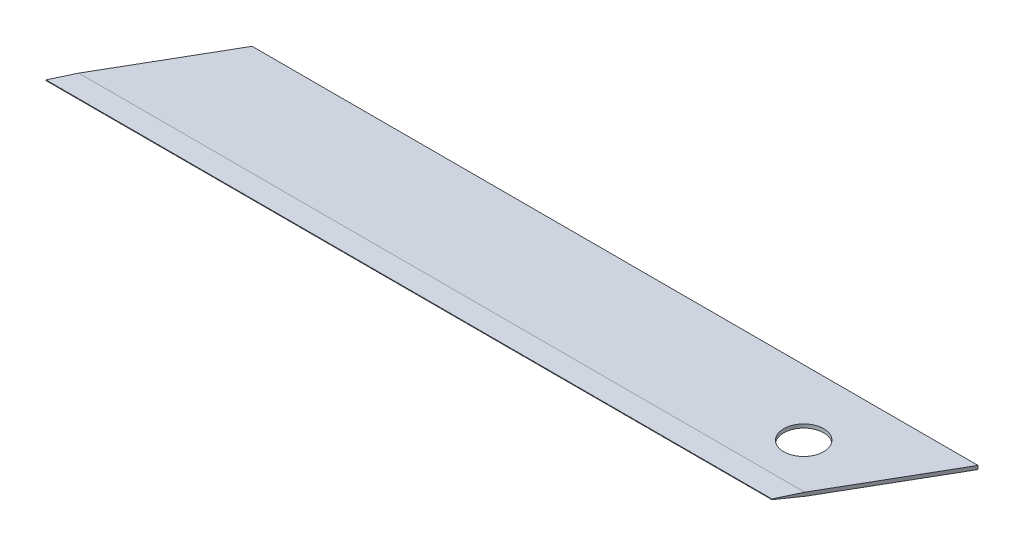
from build123d import *

# Parameters (mm, degrees)
EXTRUDE_1_DEPTH     = 0.5
SKETCH_2_R          = 2.75
CUT_EXTRUDE_1_DEPTH = 10
CHAMFER_1_SIZE      = 3
CHAMFER_1_SIZE2     = 0.209780436
CHAMFER_2_SIZE      = 0.2
CHAMFER_2_SIZE2     = 2.860133251


with BuildPart() as part:
    # 草图1 → 凸台-拉伸1 (new body)
    with BuildSketch(Plane(origin=(0, 0, 0), x_dir=(1, 0, 0), z_dir=(0, 1, 0))):
        Polygon((0, 0), (10.392304845, 18), (110.392304845, 18), (100, 0), align=None)
    extrude(amount=EXTRUDE_1_DEPTH)

    # 草图2 → 切除-拉伸1 (cut)
    with BuildSketch(Plane(origin=(0, 0, 0), x_dir=(-1, 0, 0), z_dir=(0, -1, 0))):
        with Locations((-95.381197846, 9)):
            Circle(SKETCH_2_R)
    extrude(amount=-CUT_EXTRUDE_1_DEPTH, mode=Mode.SUBTRACT)

    # 倒角1
    chamfer_1_edges = [part.edges().sort_by_distance(p)[0] for p in [
        (50, 0, 0),
    ]]
    chamfer_1_side = [part.faces().sort_by_distance(p)[0] for p in [
        (54.658653422, 0, -9),
    ]]
    chamfer(chamfer_1_edges, length=CHAMFER_1_SIZE, length2=CHAMFER_1_SIZE2, reference=chamfer_1_side[0])

    # 倒角2
    chamfer_2_edges = [part.edges().sort_by_distance(p)[0] for p in [
        (50, 0.5, 0),
    ]]
    chamfer_2_side = [part.faces().sort_by_distance(p)[0] for p in [
        (50, 0.354890218, 0),
    ]]
    chamfer(chamfer_2_edges, length=CHAMFER_2_SIZE, length2=CHAMFER_2_SIZE2, reference=chamfer_2_side[0])


solid = part.part
